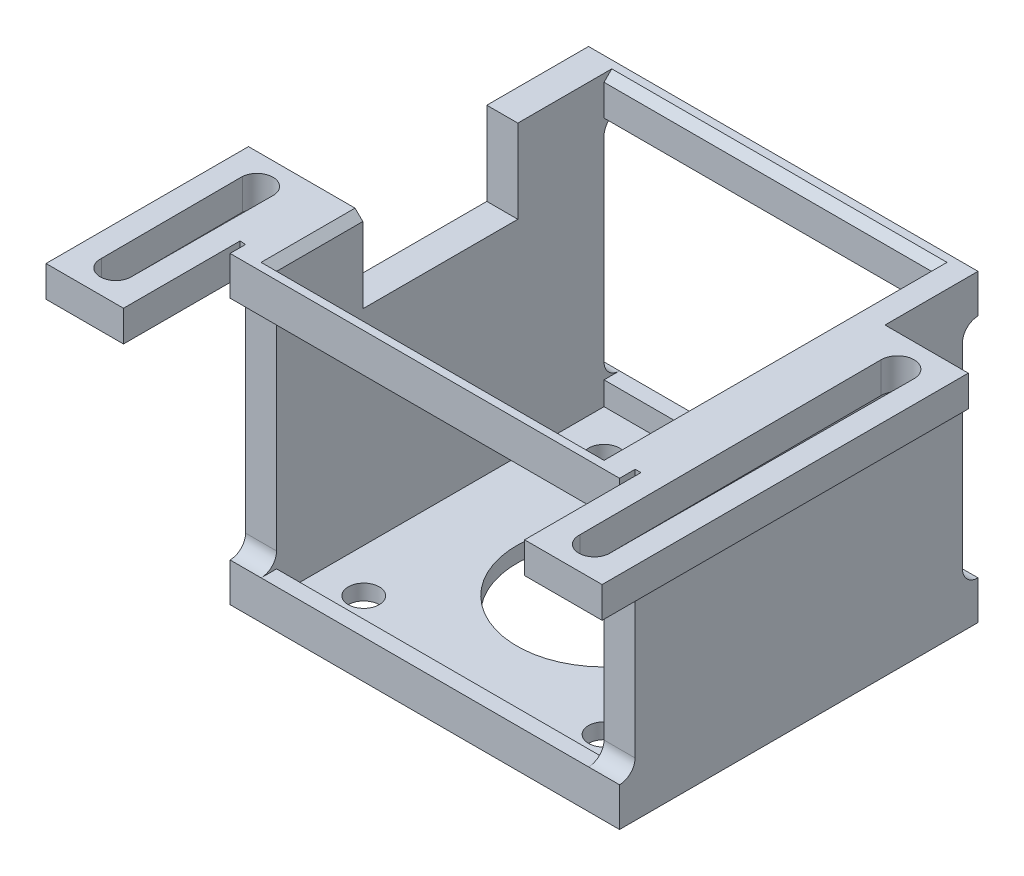
from build123d import *

# Parameters (mm, degrees)
SKETCH1_W                      = 42.25
SKETCH1_H                      = 42.25
BOSS_EXTRUDE1_DEPTH            = 2
CUT_EXTRUDE1_REACH             = 31.942
SKETCH7_R                      = 11.25
BOSS_EXTRUDE6_DEPTH            = 37.25
BOSS_EXTRUDE6_DEPTH_BACK       = 2
SKETCH9_W                      = 4
SKETCH9_H                      = 42.25
BOSS_EXTRUDE7_DEPTH            = 4
CUT_EXTRUDE2_REACH             = 83.034
SKETCH11_W                     = 10.75
SKETCH11_H                     = 20
CUT_EXTRUDE2_DIRECTION_2_DEPTH = 82.034425555
SKETCH12_W                     = 50.25
SKETCH12_H                     = 5
BOSS_EXTRUDE8_DEPTH            = 2
FILLET2_R                      = 2
CUT_EXTRUDE4_DEPTH             = 64.084021352
CUT_EXTRUDE4_DEPTH_BACK        = 64.084021352
SKETCH13_R                     = 2
CHAMFER1_SIZE                  = 1
CUT_EXTRUDE5_REACH             = 63.924
SKETCH14_W                     = 12.88865459
SKETCH14_H                     = 5.96822717
CUT_EXTRUDE5_DIRECTION_2_DEPTH = 62.924096683
BOSS_EXTRUDE9_DEPTH            = 4


with BuildPart() as part:
    # Sketch1 → Boss-Extrude1 (new body)
    with BuildSketch(Plane(origin=(0, 0, 0), x_dir=(1, 0, 0), z_dir=(0, 1, 0))):
        Rectangle(SKETCH1_W, SKETCH1_H)
    extrude(amount=BOSS_EXTRUDE1_DEPTH)

    # Sketch7 → Cut-Extrude1 (cut, up to next)
    with BuildSketch(Plane.XZ, mode=Mode.PRIVATE) as cut_extrude1_sk1:
        with Locations(Location((0, 0, 0), (0, 0, 270))):
            Circle(SKETCH7_R)
    cut_extrude1_tool1 = extrude(cut_extrude1_sk1.sketch, amount=-CUT_EXTRUDE1_REACH, mode=Mode.PRIVATE) & part.part
    add(cut_extrude1_tool1.solids().sort_by_distance((0, 0, 0))[0], mode=Mode.SUBTRACT)

    # Sketch9 → Boss-Extrude6 (add, two sides: drawn at the far end of the back side and taken through both)
    with BuildSketch(Plane(origin=(0, 2, 0), x_dir=(1, 0, 0), z_dir=(0, 1, 0)).offset(-BOSS_EXTRUDE6_DEPTH_BACK)):
        with Locations((-23.125, 0)):
            Rectangle(SKETCH9_W, SKETCH9_H)
        with Locations((23.125, 0)):
            Rectangle(SKETCH9_W, SKETCH9_H)
    extrude(amount=BOSS_EXTRUDE6_DEPTH + BOSS_EXTRUDE6_DEPTH_BACK)

    # Sketch8 → Boss-Extrude7 (add)
    # profile 1 of 2: a face of its own
    with BuildSketch(Plane(origin=(0, 39.25, 0), x_dir=(1, 0, 0), z_dir=(0, 1, 0))):
        Polygon((-25.125, -21.125), (-25.125, 11.125), (-35.875, 11.125), (-35.875, -36.125), (-25.875, -36.125), (-25.875, -21.085491291), align=None)
        with BuildLine():
            Line((-32.867964016, -31.957386071), (-33, 7))
            ThreePointArc((-33, 7), (-30.875, 9.125), (-28.75, 7))
            Line((-28.75, 7), (-28.878451254, -32.007555956))
            ThreePointArc((-28.878451254, -32.007555956), (-30.900148895, -34.124841877), (-32.867964016, -31.957386071))
        make_face(mode=Mode.SUBTRACT)
    # profile 2 of 2: a face of its own
    with BuildSketch(Plane(origin=(0, 39.25, 0), x_dir=(1, 0, 0), z_dir=(0, 1, 0))):
        Polygon((25.875, -21.085491291), (25.125, -21.125), (25.125, 11.125), (35.875, 11.125), (35.875, -36.125), (25.875, -36.125), align=None)
        with BuildLine():
            Line((28.878451254, -32.007555956), (28.75, 7))
            ThreePointArc((28.75, 7), (30.875, 9.125), (33, 7))
            Line((33, 7), (32.867964016, -31.957386071))
            ThreePointArc((32.867964016, -31.957386071), (30.900148895, -34.124841877), (28.878451254, -32.007555956))
        make_face(mode=Mode.SUBTRACT)
    extrude(amount=-BOSS_EXTRUDE7_DEPTH)

    # Sketch11 → Cut-Extrude2 (cut, up to next)
    with BuildSketch(Plane(origin=(-25.125, 0, 0), x_dir=(0, -1, 0), z_dir=(-1, 0, 0)), mode=Mode.PRIVATE) as cut_extrude2_sk1:
        with Locations((-33.875, 0)):
            Rectangle(SKETCH11_W, SKETCH11_H)
    cut_extrude2_tool1 = extrude(cut_extrude2_sk1.sketch, amount=-CUT_EXTRUDE2_REACH, mode=Mode.PRIVATE) & part.part
    add(cut_extrude2_tool1.solids().sort_by_distance((-25.125, 33.875, 0))[0], mode=Mode.SUBTRACT)

    # Sketch11 → Cut-Extrude2 direction 2 (cut)
    with BuildSketch(Plane(origin=(-25.125, 0, 0), x_dir=(0, -1, 0), z_dir=(-1, 0, 0))):
        with Locations((-33.875, 0)):
            Rectangle(SKETCH11_W, SKETCH11_H)
    extrude(amount=CUT_EXTRUDE2_DIRECTION_2_DEPTH, mode=Mode.SUBTRACT)

    # Sketch12 → Boss-Extrude8 (add)
    with BuildSketch(Plane.XY.offset(21.125)):
        with Locations((0, 36.75)):
            Rectangle(SKETCH12_W, SKETCH12_H)
        with Locations((0, 2.5)):
            Rectangle(SKETCH12_W, SKETCH12_H)
    boss_extrude8 = extrude(amount=BOSS_EXTRUDE8_DEPTH)

    # Mirror1: Boss-Extrude8 across plane
    add(boss_extrude8.mirror(Plane.XY))

    # Fillet2
    fillet2_edges = [part.edges().sort_by_distance(p)[0] for p in [
        (-23.125, 5, -21.125),
        (23.125, 5, -21.125),
        (23.125, 34.25, -21.125),
        (-23.125, 34.25, -21.125),
        (23.125, 34.25, 21.125),
        (23.125, 5, 21.125),
        (-23.125, 5, 21.125),
        (-23.125, 34.25, 21.125),
    ]]
    fillet(fillet2_edges, radius=FILLET2_R - 0.0001)  # a hair under: the kernel refuses the full size

    # Sketch13 → Cut-Extrude4 (cut, two sides: drawn at the far end of the back side and taken through both)
    with BuildSketch(Plane.XZ.offset(-2).offset(-CUT_EXTRUDE4_DEPTH_BACK)):
        with Locations((-15.499999999, 15.5)):
            Circle(SKETCH13_R)
        with Locations((15.500000001, 15.5)):
            Circle(SKETCH13_R)
        with Locations((15.500000001, -15.5)):
            Circle(SKETCH13_R)
        with Locations((-15.499999999, -15.5)):
            Circle(SKETCH13_R)
    extrude(amount=CUT_EXTRUDE4_DEPTH + CUT_EXTRUDE4_DEPTH_BACK, mode=Mode.SUBTRACT)

    # Chamfer1
    chamfer1_edges = [part.edges().sort_by_distance(p)[0] for p in [
        (0, 39.25, 21.125),
        (0, 39.25, -21.125),
        (-21.125, 39.25, 15.5625),
        (21.125, 39.25, 0),
    ]]
    chamfer(chamfer1_edges, length=CHAMFER1_SIZE)

    # Sketch14 → Cut-Extrude5 (cut, up to next)
    with BuildSketch(Plane.XZ.offset(-35.25), mode=Mode.PRIVATE) as cut_extrude5_sk1:
        with Locations((-31.569327295, -11.445399839)):
            Rectangle(SKETCH14_W, SKETCH14_H)
    cut_extrude5_tool1 = extrude(cut_extrude5_sk1.sketch, amount=-CUT_EXTRUDE5_REACH, mode=Mode.PRIVATE) & part.part
    add(cut_extrude5_tool1.solids().sort_by_distance((-31.569327, 35.25, -11.4454))[0], mode=Mode.SUBTRACT)

    # Sketch14 → Cut-Extrude5 direction 2 (cut)
    with BuildSketch(Plane.XZ.offset(-35.25)):
        with Locations((-31.569327295, -11.445399839)):
            Rectangle(SKETCH14_W, SKETCH14_H)
    extrude(amount=CUT_EXTRUDE5_DIRECTION_2_DEPTH, mode=Mode.SUBTRACT)

    # Sketch15 → Boss-Extrude9 (add)
    with BuildSketch(Plane.XZ.offset(-35.25)):
        with BuildLine():
            Line((-25.125, 10), (-35.875, 10))
            Line((-35.875, 10), (-35.875, 14))
            Line((-35.875, 14), (-32.933785094, 14))
            ThreePointArc((-32.933785094, 14), (-30.875982387, 11.837870103), (-28.81817968, 14))
            Line((-28.81817968, 14), (-25.125, 14))
            Line((-25.125, 14), (-25.125, 10))
        make_face()
    extrude(amount=-BOSS_EXTRUDE9_DEPTH)


solid = part.part
